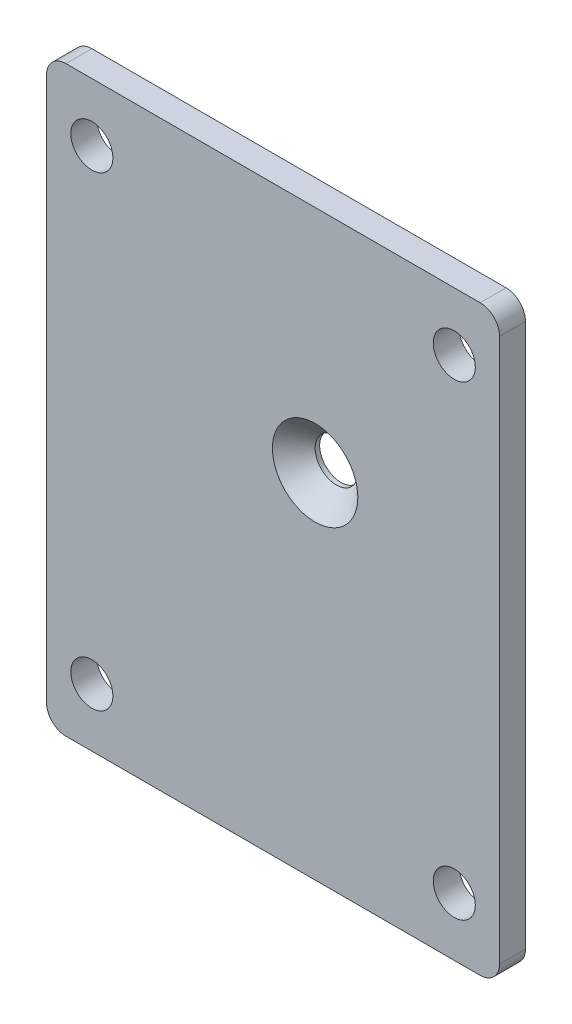
from build123d import *

# Parameters (mm, degrees)
SKETCH_1_W                  = 55
SKETCH_1_H                  = 60
EXTRUDE_1_DEPTH             = 16.5
HOLE_WIZARD_3_6_3_6_1_D     = 3.6
HOLE_WIZARD_3_6_3_6_1_DEPTH = 25
HOLE_WIZARD_3_6_3_6_1_TIP   = 1.081549114
HOLE_WIZARD_M2_5_1_D        = 2.05
HOLE_WIZARD_M2_5_1_DEPTH    = 14
HOLE_WIZARD_M2_5_1_TIP      = 0.615882135
SKETCH_8_W                  = 35
SKETCH_8_H                  = 20.4
CUT_EXTRUDE_1_DEPTH         = 44.914690025
CUT_EXTRUDE_START           = 2.5
SKETCH_9_W                  = 20
SKETCH_9_H                  = 6
CUT_EXTRUDE_2_DEPTH         = 42.414690025
SHELL_START                 = 1.8
SHELL_1_DEPTH               = 14.7
EXTRUDE_2_DEPTH             = 4
SKETCH_16_R                 = 3
CUT_EXTRUDE_4_DEPTH         = 12
CUT_EXTRUDE_5_DEPTH         = 45.787721532
CUT_EXTRUDE_5_DEPTH_BACK    = 45.787721532
SKETCH_17_R                 = 2.5
FILLET_1_R                  = 0.5
FILLET_2_R                  = 0.5
SKETCH_21_W                 = 70
SKETCH_21_H                 = 90
EXTRUDE_3_DEPTH             = 4
SKETCH_24_R                 = 8.656208536
SKETCH_24_R_2               = 4.782814597
EXTRUDE_4_DEPTH             = 4
HOLE_WIZARD_6_5_6_5_1_D     = 6.5
HOLE_WIZARD_1_D             = 6.6
HOLE_WIZARD_1_DEPTH         = 17
HOLE_WIZARD_1_CSINK_D       = 13.2
HOLE_WIZARD_1_CSINK_ANGLE   = 90
HOLE_WIZARD_1_TIP           = 1.982840043
FILLET_3_R                  = 3


# Read off the part's stored shape, not the designer's step: 抽壳1
with BuildPart() as part:
    # 草图1 → 凸台-拉伸1 (new body)
    with BuildSketch(Plane.XY):
        Rectangle(SKETCH_1_W, SKETCH_1_H)
    extrude(amount=EXTRUDE_1_DEPTH)

    # Ø3.6 (3.6) 直径孔1
    with Locations(Plane.XY.offset(16.5)):
        with Locations((-24, 21.5), (24, 21.5), (24, -6), (-15, -26.5)):
            Hole(HOLE_WIZARD_3_6_3_6_1_D / 2, depth=HOLE_WIZARD_3_6_3_6_1_DEPTH)
            with Locations((0, 0, -(HOLE_WIZARD_3_6_3_6_1_DEPTH + HOLE_WIZARD_3_6_3_6_1_TIP / 2))):  # 118° drill point
                Cone(0, HOLE_WIZARD_3_6_3_6_1_D / 2, HOLE_WIZARD_3_6_3_6_1_TIP, mode=Mode.SUBTRACT)

    # M2.5 螺纹孔1
    with Locations(Plane.XY.offset(16.5)):
        with Locations((-24, 26.5), (24, 26.5), (24, -1), (-22.5, -26.5)):
            Hole(HOLE_WIZARD_M2_5_1_D / 2, depth=HOLE_WIZARD_M2_5_1_DEPTH)
            with Locations((0, 0, -(HOLE_WIZARD_M2_5_1_DEPTH + HOLE_WIZARD_M2_5_1_TIP / 2))):  # 118° drill point
                Cone(0, HOLE_WIZARD_M2_5_1_D / 2, HOLE_WIZARD_M2_5_1_TIP, mode=Mode.SUBTRACT)

    # 草图8 → 切除-拉伸1 (cut, through all)
    with BuildSketch(Plane.XY.offset(16.5)):
        with Locations((10, -19.8)):
            Rectangle(SKETCH_8_W, SKETCH_8_H)
    extrude(amount=-CUT_EXTRUDE_1_DEPTH, mode=Mode.SUBTRACT)

    # 草图9 → 切除-拉伸2 (cut, through all)
    with BuildSketch(Plane(origin=(0, 0, 16.5), x_dir=(-1, 0, 0), z_dir=(0, 0, -1)).offset(CUT_EXTRUDE_START)):
        with Locations((17.5, -27)):
            Rectangle(SKETCH_9_W, SKETCH_9_H)
    extrude(amount=CUT_EXTRUDE_2_DEPTH, mode=Mode.SUBTRACT)

    # 抽壳1 outline → 抽壳1 (cut)
    with BuildSketch(Plane.XY.offset(SHELL_START)):
        with BuildLine():
            ThreePointArc((-21.743758657, 28.2), (-21.182110509, 26.299690696), (-22.006919283, 24.4979375))
            ThreePointArc((-22.006919283, 24.4979375), (-20.910890356, 19.651378458), (-25.7, 18.326673669))
            Line((-25.7, 18.326673669), (-25.7, -22.2))
            Line((-25.7, -22.2), (-9.3, -22.2))
            Line((-9.3, -22.2), (-9.3, -7.8))
            Line((-9.3, -7.8), (20.882308546, -7.8))
            ThreePointArc((20.882308546, -7.8), (20.494996561, -5.178446051), (22.006919283, -3.0020625))
            ThreePointArc((22.006919283, -3.0020625), (21.865811165, 0.8509087), (25.7, 1.256241343))
            Line((25.7, 1.256241343), (25.7, 18.326673669))
            ThreePointArc((25.7, 18.326673669), (20.910890356, 19.651378458), (22.006919283, 24.4979375))
            ThreePointArc((22.006919283, 24.4979375), (21.182110509, 26.299690696), (21.743758657, 28.2))
            Line((21.743758657, 28.2), (-21.743758657, 28.2))
        make_face()
    extrude(amount=SHELL_1_DEPTH, mode=Mode.SUBTRACT)

    # 草图16 → 切除-拉伸4 (cut)
    with BuildSketch(Plane(origin=(-7.5, 0, 0), x_dir=(0, 0, -1), z_dir=(1, 0, 0))):
        with Locations(Location((-8, -18, 0), (0, 0, 90))):
            Circle(SKETCH_16_R)
    extrude(amount=-CUT_EXTRUDE_4_DEPTH, mode=Mode.SUBTRACT)


with BuildPart() as body_2:
    # 草图10 → 凸台-拉伸2 (new body)
    with BuildSketch(Plane.XY.offset(16.5)):
        Polygon((-27.5, -30), (-7.5, -30), (-7.5, -9.6), (27.5, -9.6), (27.5, 30), (-27.5, 30), align=None)
    extrude(amount=EXTRUDE_2_DEPTH)


with BuildPart() as cut_extrude_5_tool:
    # 草图17 → 切除-拉伸5 (new, two sides: drawn at the far end of the back side and taken through both)
    with BuildSketch(Plane.XY.offset(1.8).offset(-CUT_EXTRUDE_5_DEPTH_BACK)):
        with Locations((6.5, 9.5)):
            Circle(SKETCH_17_R)
    extrude(amount=CUT_EXTRUDE_5_DEPTH + CUT_EXTRUDE_5_DEPTH_BACK)


with BuildPart() as part_1:
    add(part.part)

    # 切除-拉伸5: cut by cut_extrude_5_tool
    add(cut_extrude_5_tool.part, mode=Mode.SUBTRACT)

    # 圆角1
    fillet_1_edges = [part_1.edges().sort_by_distance(p)[0] for p in [
        (-27.5, 3, 0),
        (0, 30, 0),
        (27.5, 10.2, 0),
        (27.5, -9.6, 8.25),
        (-7.5, -16.8, 0),
        (10, -9.6, 0),
        (-7.5, -9.6, 8.25),
        (-7.5, -30, 15.25),
        (-27.5, -30, 15.25),
        (-27.5, 30, 8.25),
        (27.5, 30, 8.25),
        (-17.5, -24, 0),
        (-7.5, -24, 7),
        (-27.5, -24, 7),
    ]]
    fillet(fillet_1_edges, radius=FILLET_1_R)


with BuildPart() as body_2_1:
    add(body_2.part)

    # 切除-拉伸5: cut by cut_extrude_5_tool
    add(cut_extrude_5_tool.part, mode=Mode.SUBTRACT)

    # 圆角2
    fillet_2_edges = [body_2_1.edges().sort_by_distance(p)[0] for p in [
        (-27.5, 30, 18.5),
        (27.5, 30, 18.5),
        (27.5, -9.6, 18.5),
        (-7.5, -9.6, 18.5),
        (-7.5, -30, 18.5),
        (-27.5, -30, 18.5),
    ]]
    fillet(fillet_2_edges, radius=FILLET_2_R)

    # 草图21 → 凸台-拉伸3 (add)
    with BuildSketch(Plane.XY.offset(20.5)):
        Rectangle(SKETCH_21_W, SKETCH_21_H)
        with BuildLine():
            Line((-27, -30), (-8, -30))
            ThreePointArc((-8, -30), (-7.646446609, -29.853553391), (-7.5, -29.5))
            Line((-7.5, -29.5), (-7.5, -10.1))
            ThreePointArc((-7.5, -10.1), (-7.353553391, -9.746446609), (-7, -9.6))
            Line((-7, -9.6), (27, -9.6))
            ThreePointArc((27, -9.6), (27.353553391, -9.453553391), (27.5, -9.1))
            Line((27.5, -9.1), (27.5, 29.5))
            ThreePointArc((27.5, 29.5), (27.353553391, 29.853553391), (27, 30))
            Line((27, 30), (-27, 30))
            ThreePointArc((-27, 30), (-27.353553391, 29.853553391), (-27.5, 29.5))
            Line((-27.5, 29.5), (-27.5, -29.5))
            ThreePointArc((-27.5, -29.5), (-27.353553391, -29.853553391), (-27, -30))
        make_face(mode=Mode.SUBTRACT)
    extrude(amount=-EXTRUDE_3_DEPTH)

    # 草图24 → 凸台-拉伸4 (add)
    with BuildSketch(Plane(origin=(0, 0, 16.5), x_dir=(-1, 0, 0), z_dir=(0, 0, -1))):
        with Locations((-6.5, 9.5)):
            Circle(SKETCH_24_R)
        with Locations((-6.5, 9.5)):
            Circle(SKETCH_24_R_2, mode=Mode.SUBTRACT)
    extrude(amount=-EXTRUDE_4_DEPTH)

    # Ø6.5 (6.5) 直径孔1 (through all)
    with Locations(Plane.XY.offset(20.5)):
        with Locations((-28, 36), (28, 36), (28, -36), (-28, -36)):
            Hole(HOLE_WIZARD_6_5_6_5_1_D / 2)

    # 打孔尺寸(%根据十字)槽沉头木螺钉的类型1
    with Locations(Plane.XY.offset(20.5)):
        with Locations((6.5, 9.5)):
            CounterSinkHole(HOLE_WIZARD_1_D / 2, HOLE_WIZARD_1_CSINK_D / 2, depth=HOLE_WIZARD_1_DEPTH, counter_sink_angle=HOLE_WIZARD_1_CSINK_ANGLE)
            with Locations((0, 0, -(HOLE_WIZARD_1_DEPTH + HOLE_WIZARD_1_TIP / 2))):  # 118° drill point
                Cone(0, HOLE_WIZARD_1_D / 2, HOLE_WIZARD_1_TIP, mode=Mode.SUBTRACT)

    # 圆角3
    fillet_3_edges = [body_2_1.edges().sort_by_distance(p)[0] for p in [
        (-35, 45, 18.5),
        (-35, -45, 18.5),
        (35, -45, 18.5),
        (35, 45, 18.5),
    ]]
    fillet(fillet_3_edges, radius=FILLET_3_R)


solid = body_2_1.part
